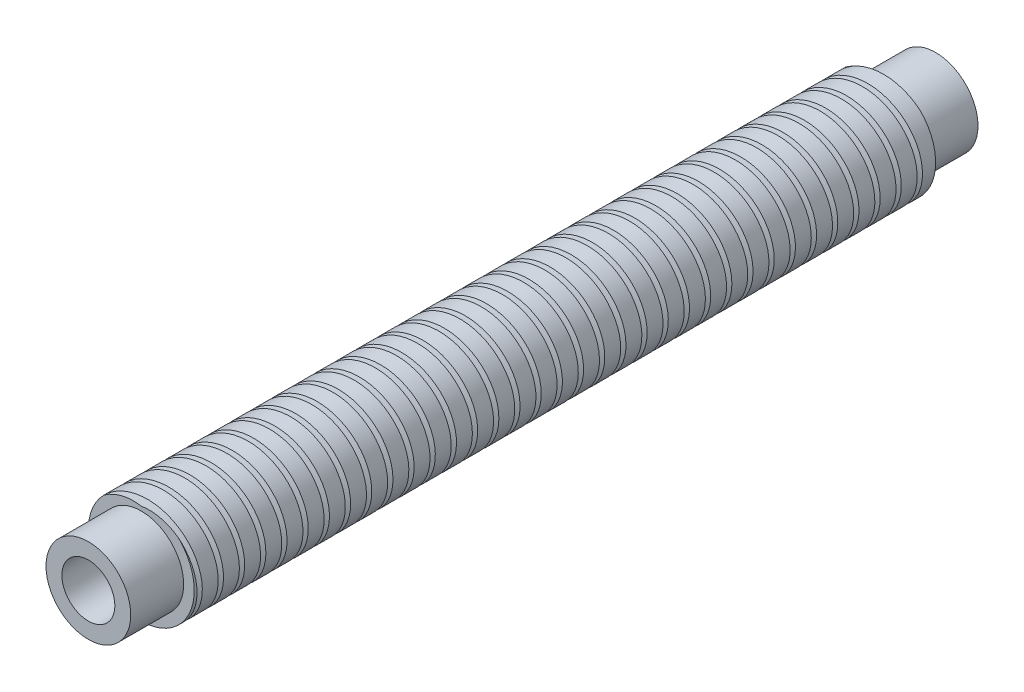
from build123d import *

# Parameters (mm, degrees)
SKETCH1_R           = 4
BOSS_EXTRUDE1_DEPTH = 5
SKETCH2_R           = 5
BOSS_EXTRUDE2_DEPTH = 35
SKETCH3_R           = 4
BOSS_EXTRUDE3_DEPTH = 5
SKETCH6_R           = 2.5
CUT_EXTRUDE1_DEPTH  = 10
CUT_SWEEP3_PITCH    = 2


with BuildPart() as part:
    # Sketch1 → Boss-Extrude1 (new body)
    with BuildSketch(Plane.XY):
        Circle(SKETCH1_R)
    extrude(amount=BOSS_EXTRUDE1_DEPTH)

    # Sketch2 → Boss-Extrude2 (add)
    with BuildSketch(Plane.XY.offset(5)):
        Circle(SKETCH2_R)
    boss_extrude2 = extrude(amount=BOSS_EXTRUDE2_DEPTH)

    # Mirror1: Boss-Extrude2 across plane
    add(boss_extrude2.mirror(Plane.XY.offset(40)))

    # Sketch3 → Boss-Extrude3 (add)
    with BuildSketch(Plane.XY.offset(75)):
        Circle(SKETCH3_R)
    extrude(amount=BOSS_EXTRUDE3_DEPTH)

    # Sketch6 → Cut-Extrude1 (cut)
    with BuildSketch(Plane.XY.offset(80)):
        Circle(SKETCH6_R)
    extrude(amount=-CUT_EXTRUDE1_DEPTH, mode=Mode.SUBTRACT)

    # Cut-Sweep3: arcs per turn and ends read off the stored shape
    # Cut-Sweep3: the profile of Sketch4 screwed along a right-hand helix through 36 turns, 10 arcs to a turn; built about Z, then put on its axis
    cut_sweep3_z = Axis((0, 0, 0), (0, 0, 1))
    cut_sweep3_corners = [(5, -8.73e-07, -0.500000056), (5, -8.73e-07, -0.750000056), (4.396446609, -7.67e-07, -0.500000056), (5, -8.73e-07, -0.250000056)]
    with BuildLine(mode=Mode.PRIVATE) as cut_sweep3_profile:
        Line(cut_sweep3_corners[0], cut_sweep3_corners[1])
        Line(cut_sweep3_corners[1], cut_sweep3_corners[2])
        Line(cut_sweep3_corners[2], cut_sweep3_corners[3])
        Line(cut_sweep3_corners[3], cut_sweep3_corners[0])
    cut_sweep3_cap = Face(cut_sweep3_profile.wire())
    cut_sweep3_turn_angles = [0, 18, 36, 54, 72, 90, 108, 126, 144, 162, 180, 198, 216, 234, 252, 270, 288, 306, 324, 342, 360]
    cut_sweep3_turn_weights = [1, 0.9510565162951535, 1, 0.9510565162951535, 1, 0.9510565162951535, 1, 0.9510565162951535, 1, 0.9510565162951535, 1, 0.9510565162951535, 1, 0.9510565162951535, 1, 0.9510565162951535, 1, 0.9510565162951535, 1, 0.9510565162951535, 1]
    cut_sweep3_turn_rails = [Edge.make_bspline([Vector(p[0], p[1], 0).rotate(cut_sweep3_z, cut_sweep3_turn_angles[k]) / cut_sweep3_turn_weights[k] + Vector(0, 0, p[2] + CUT_SWEEP3_PITCH * cut_sweep3_turn_angles[k] / 360) for k in range(21)], [0, 0, 0, 1, 1, 2, 2, 3, 3, 4, 4, 5, 5, 6, 6, 7, 7, 8, 8, 9, 9, 10, 10, 10], 2, cut_sweep3_turn_weights) for p in cut_sweep3_corners]
    cut_sweep3_turn_sides = [Face.make_surface_from_curves(cut_sweep3_turn_rails[p[0]], cut_sweep3_turn_rails[p[1]]) for p in [(0, 1), (1, 2), (2, 3), (3, 0)]]
    cut_sweep3 = Plane(origin=(0, 0, 5), x_dir=(1, 0, 0), z_dir=(0, 0, 1)) * Solid(Shell([*[p.moved(Location((0, 0, CUT_SWEEP3_PITCH * i))) for i in range(36) for p in cut_sweep3_turn_sides], cut_sweep3_cap, cut_sweep3_cap.rotate(cut_sweep3_z, 12960).moved(Location((0, 0, CUT_SWEEP3_PITCH * 12960 / 360)))]))
    add(cut_sweep3, mode=Mode.SUBTRACT)


solid = part.part
